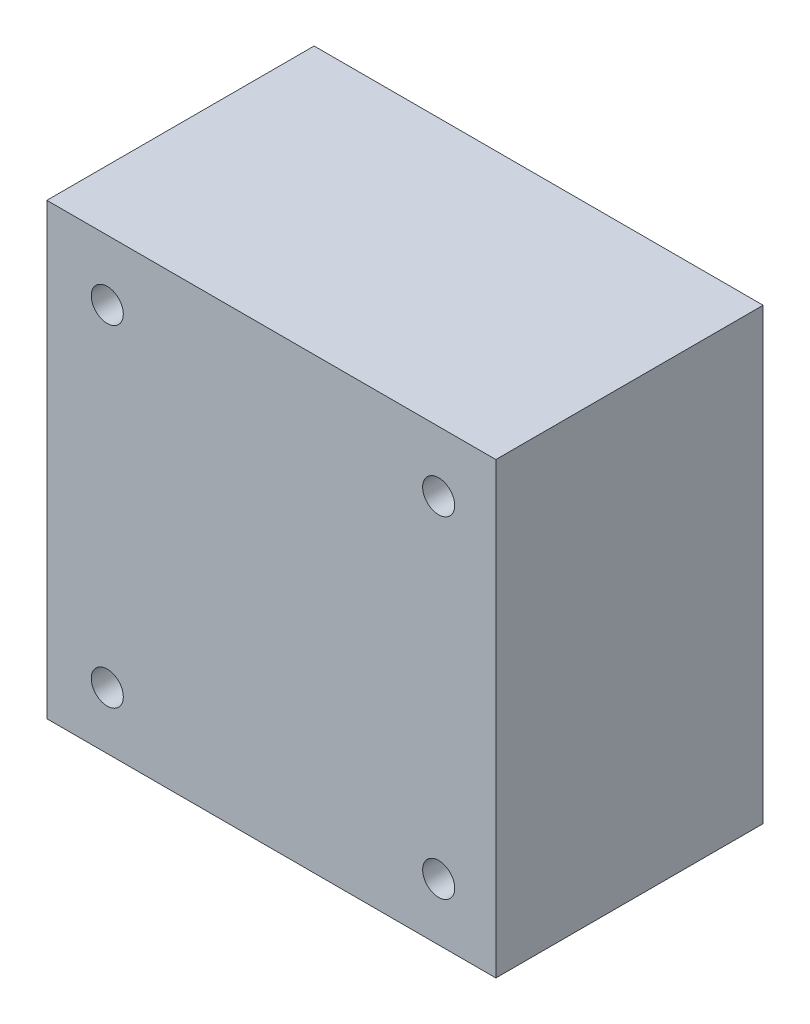
from build123d import *

# Parameters (mm, degrees)
SKETCH1_W           = 42
SKETCH1_H           = 42
BOSS_EXTRUDE1_DEPTH = 25
SKETCH2_R           = 1.5
CUT_EXTRUDE1_DEPTH  = 39.820097888


with BuildPart() as part:
    # Sketch1 → Boss-Extrude1 (new body)
    with BuildSketch(Plane.XY):
        Rectangle(SKETCH1_W, SKETCH1_H)
    extrude(amount=BOSS_EXTRUDE1_DEPTH)

    # Sketch2 → Cut-Extrude1 (cut, through all)
    with BuildSketch(Plane.XY.offset(25)):
        with Locations((15.65, 15.35)):
            Circle(SKETCH2_R)
        with Locations((-15.35, 15.35)):
            Circle(SKETCH2_R)
        with Locations((-15.35, -15.65)):
            Circle(SKETCH2_R)
        with Locations((15.65, -15.65)):
            Circle(SKETCH2_R)
    extrude(amount=-CUT_EXTRUDE1_DEPTH, mode=Mode.SUBTRACT)


solid = part.part
